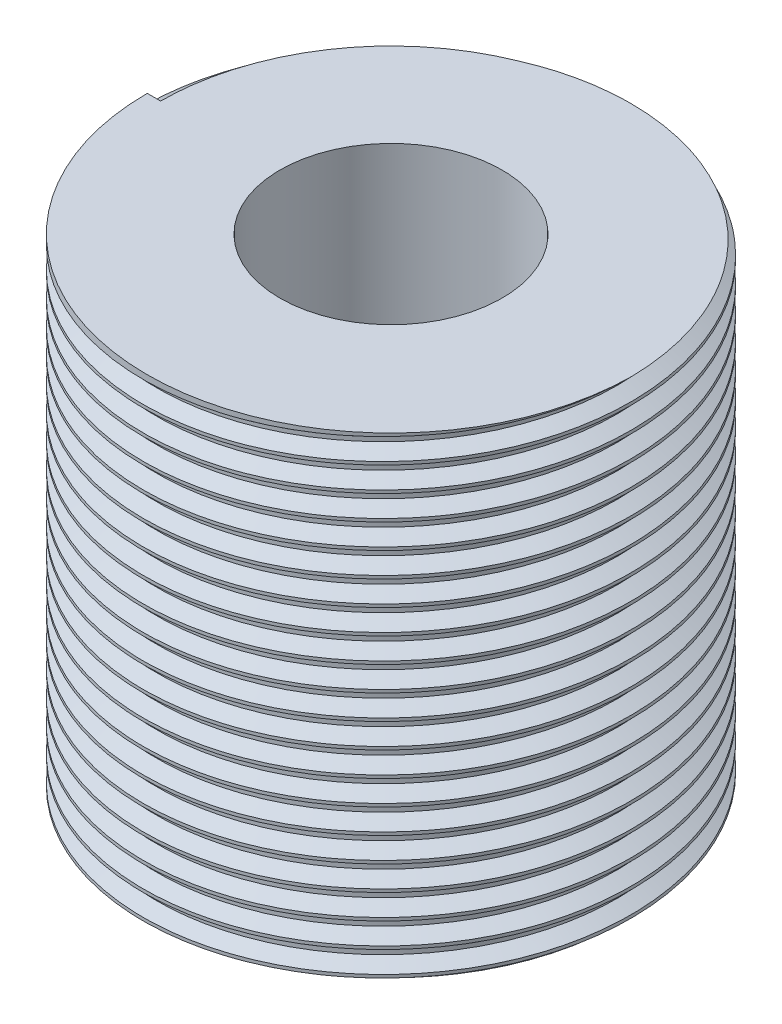
from build123d import *

# Parameters (mm, degrees)
SKETCH1_R               = 19.75
BOSS_EXTRUDE1_DEPTH     = 40
THREAD1_PITCH           = 2
CUT_EXTRUDE1_DEPTH      = 49.786524942
CUT_EXTRUDE1_DEPTH_BACK = 49.786524942
SKETCH4_R               = 9
CUT_EXTRUDE2_DEPTH      = 49.786525434
CUT_EXTRUDE2_DEPTH_BACK = 49.786525434
SKETCH5_W               = 52.36024749
SKETCH5_H               = 5.7217043


with BuildPart() as part:
    # Sketch1 → Boss-Extrude1 (new body)
    with BuildSketch(Plane(origin=(0, 0, 0), x_dir=(1, 0, 0), z_dir=(0, 1, 0))):
        with Locations(Location((0, 0, 0), (0, 0, 270))):
            Circle(SKETCH1_R)
    extrude(amount=BOSS_EXTRUDE1_DEPTH)

    # Thread1: the profile of Thread Profile1 profile screwed along a right-hand helix of 20 turns, 10 arcs to a turn; built about Z, then put on its axis
    thread1_z = Axis((0, 0, 0), (0, 0, 1))
    thread1_corners = [(19.7503, 0, -0.000173205), (19.7503, 0, 1.7501732), (18.66746825, 0, 1.124999997), (18.66746825, 0, 0.624999997)]
    with BuildLine(mode=Mode.PRIVATE) as thread1_profile:
        Line(thread1_corners[0], thread1_corners[1])
        Line(thread1_corners[1], thread1_corners[2])
        Line(thread1_corners[2], thread1_corners[3])
        Line(thread1_corners[3], thread1_corners[0])
    thread1_cap = Face(thread1_profile.wire())
    thread1_turn_angles = [0, 18, 36, 54, 72, 90, 108, 126, 144, 162, 180, 198, 216, 234, 252, 270, 288, 306, 324, 342, 360]
    thread1_turn_weights = [1, 0.9510565162951535, 1, 0.9510565162951535, 1, 0.9510565162951535, 1, 0.9510565162951535, 1, 0.9510565162951535, 1, 0.9510565162951535, 1, 0.9510565162951535, 1, 0.9510565162951535, 1, 0.9510565162951535, 1, 0.9510565162951535, 1]
    thread1_turn_rails = [Edge.make_bspline([Vector(p[0], p[1], 0).rotate(thread1_z, thread1_turn_angles[k]) / thread1_turn_weights[k] + Vector(0, 0, p[2] + THREAD1_PITCH * thread1_turn_angles[k] / 360) for k in range(21)], [0, 0, 0, 1, 1, 2, 2, 3, 3, 4, 4, 5, 5, 6, 6, 7, 7, 8, 8, 9, 9, 10, 10, 10], 2, thread1_turn_weights) for p in thread1_corners]
    thread1_turn_sides = [Face.make_surface_from_curves(thread1_turn_rails[p[0]], thread1_turn_rails[p[1]]) for p in [(0, 1), (1, 2), (2, 3), (3, 0)]]
    thread1 = Plane(origin=(0, 40, 0), x_dir=(-1, 0, 0), z_dir=(0, -1, 0)) * Solid(Shell([*[p.moved(Location((0, 0, THREAD1_PITCH * i))) for i in range(20) for p in thread1_turn_sides], thread1_cap, thread1_cap.rotate(thread1_z, 7200).moved(Location((0, 0, THREAD1_PITCH * 7200 / 360)))]))
    add(thread1, mode=Mode.SUBTRACT)

    # Sketch4 → Cut-Extrude1 (cut, two sides: drawn at the far end of the back side and taken through both)
    with BuildSketch(Plane(origin=(0, 40, 0), x_dir=(1, 0, 0), z_dir=(0, 1, 0)).offset(-CUT_EXTRUDE1_DEPTH_BACK)):
        with Locations(Location((0, 0, 0), (0, 0, 270))):
            Circle(SKETCH4_R)
    extrude(amount=CUT_EXTRUDE1_DEPTH + CUT_EXTRUDE1_DEPTH_BACK, mode=Mode.SUBTRACT)

    # Sketch5 → Cut-Extrude2 (cut, two sides: drawn at the far end of the back side and taken through both)
    with BuildSketch(Plane.XY.offset(-CUT_EXTRUDE2_DEPTH_BACK)):
        with Locations((0.309437815, 41.857191656)):
            Rectangle(SKETCH5_W, SKETCH5_H)
    extrude(amount=CUT_EXTRUDE2_DEPTH + CUT_EXTRUDE2_DEPTH_BACK, mode=Mode.SUBTRACT)


solid = part.part
